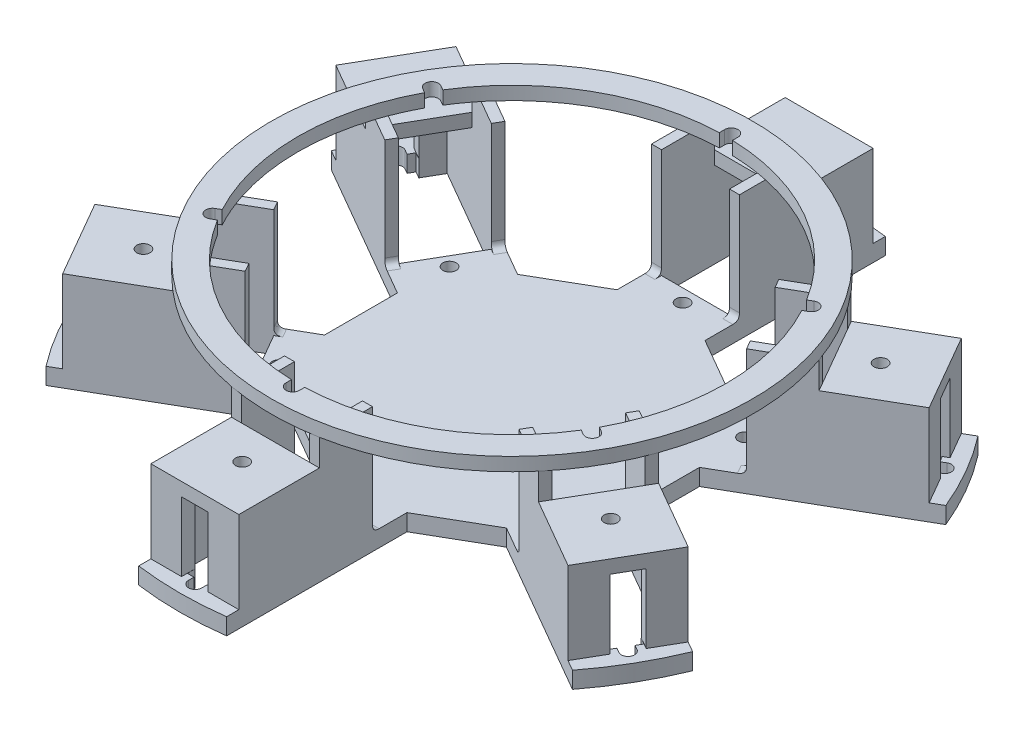
from build123d import *

# Parameters (mm, degrees)
SKETCH1_R               = 63.5
SKETCH1_R_2             = 1.27
BOSS_EXTRUDE2_DEPTH     = 3.175
CUT_EXTRUDE1_REACH      = 91.859
BOSS_EXTRUDE3_DEPTH     = 13.208
SKETCH4_W               = 5.08
SKETCH4_H               = 13.208
CUT_EXTRUDE2_DEPTH      = 13.208
CIRPATTERN2_COUNT       = 6
FILLET1_SIZE            = 1.27
SKETCH11_W              = 16.81
SKETCH11_H              = 15.402647586
BOSS_EXTRUDE7_DEPTH     = 2.54
SKETCH12_W              = 1.905
SKETCH12_H              = 10.137352414
BOSS_EXTRUDE9_DEPTH     = 7.62
SKETCH15_R              = 45.98147121
SKETCH15_R_2            = 40.90147121
BOSS_EXTRUDE12_DEPTH    = 2.54
CUT_EXTRUDE6_DEPTH      = 2.54
CUT_EXTRUDE7_DEPTH      = 89.528761012
CUT_EXTRUDE7_DEPTH_BACK = 89.528761012
SKETCH17_R              = 1.27


with BuildPart() as part:
    # Sketch1 → Boss-Extrude2 (new body)
    with BuildSketch(Plane(origin=(0, 0, 0), x_dir=(1, 0, 0), z_dir=(0, 1, 0))):
        with Locations(Location((0, 0, 0), (0, 0, 270))):
            Circle(SKETCH1_R)
        with Locations(Location((0, 32.599413337, 0), (0, 0, 270))):
            Circle(SKETCH1_R_2, mode=Mode.SUBTRACT)
        with Locations(Location((28.231920098, 16.299706668, 0), (0, 0, 270))):
            Circle(SKETCH1_R_2, mode=Mode.SUBTRACT)
        with Locations(Location((28.231920098, -16.299706668, 0), (0, 0, 270))):
            Circle(SKETCH1_R_2, mode=Mode.SUBTRACT)
        with Locations(Location((0, -32.599413337, 0), (0, 0, 270))):
            Circle(SKETCH1_R_2, mode=Mode.SUBTRACT)
        with Locations(Location((-28.231920098, -16.299706668, 0), (0, 0, 270))):
            Circle(SKETCH1_R_2, mode=Mode.SUBTRACT)
        with Locations(Location((-28.231920098, 16.299706668, 0), (0, 0, 270))):
            Circle(SKETCH1_R_2, mode=Mode.SUBTRACT)
        with BuildLine():
            Line((47.039587132, 34.663871793), (27.121002845, 23.163871793))
            Line((27.121002845, 23.163871793), (33.621002845, 11.905541544))
            Line((33.621002845, 11.905541544), (53.539587132, 23.405541544))
            Line((53.539587132, 23.405541544), (51.549939821, 26.851711776))
            Line((51.549939821, 26.851711776), (52.800278257, 27.573595009))
            Line((52.800278257, 27.573595009), (52.174925568, 28.656737638))
            Line((52.174925568, 28.656737638), (53.06366988, 29.169854406))
            ThreePointArc((53.06366988, 29.169854406), (53.528522143, 30.904706668), (51.79366988, 31.369558931))
            Line((51.79366988, 31.369558931), (50.904925568, 30.856442164))
            Line((50.904925568, 30.856442164), (50.279572879, 31.939584793))
            Line((50.279572879, 31.939584793), (49.029234444, 31.21770156))
            Line((49.029234444, 31.21770156), (47.039587132, 34.663871793))
        make_face(mode=Mode.SUBTRACT)
        with BuildLine():
            Line((-6.5, 58.069413337), (-2.520705377, 58.069413337))
            Line((-2.520705377, 58.069413337), (-2.520705377, 59.513179801))
            Line((-2.520705377, 59.513179801), (-1.27, 59.513179801))
            Line((-1.27, 59.513179801), (-1.27, 60.539413337))
            ThreePointArc((-1.27, 60.539413337), (0, 61.809413337), (1.27, 60.539413337))
            Line((1.27, 60.539413337), (1.27, 59.513179801))
            Line((1.27, 59.513179801), (2.520705377, 59.513179801))
            Line((2.520705377, 59.513179801), (2.520705377, 58.069413337))
            Line((2.520705377, 58.069413337), (6.5, 58.069413337))
            Line((6.5, 58.069413337), (6.5, 35.069413337))
            Line((6.5, 35.069413337), (-6.5, 35.069413337))
            Line((-6.5, 35.069413337), (-6.5, 58.069413337))
        make_face(mode=Mode.SUBTRACT)
        with BuildLine():
            Line((53.539587132, -23.405541544), (33.621002845, -11.905541544))
            Line((33.621002845, -11.905541544), (27.121002845, -23.163871793))
            Line((27.121002845, -23.163871793), (47.039587132, -34.663871793))
            Line((47.039587132, -34.663871793), (49.029234444, -31.21770156))
            Line((49.029234444, -31.21770156), (50.279572879, -31.939584793))
            Line((50.279572879, -31.939584793), (50.904925568, -30.856442164))
            Line((50.904925568, -30.856442164), (51.79366988, -31.369558931))
            ThreePointArc((51.79366988, -31.369558931), (53.528522143, -30.904706668), (53.06366988, -29.169854406))
            Line((53.06366988, -29.169854406), (52.174925568, -28.656737638))
            Line((52.174925568, -28.656737638), (52.800278257, -27.573595009))
            Line((52.800278257, -27.573595009), (51.549939821, -26.851711776))
            Line((51.549939821, -26.851711776), (53.539587132, -23.405541544))
        make_face(mode=Mode.SUBTRACT)
        with BuildLine():
            Line((6.5, -58.069413337), (6.5, -35.069413337))
            Line((6.5, -35.069413337), (-6.5, -35.069413337))
            Line((-6.5, -35.069413337), (-6.5, -58.069413337))
            Line((-6.5, -58.069413337), (-2.520705377, -58.069413337))
            Line((-2.520705377, -58.069413337), (-2.520705377, -59.513179801))
            Line((-2.520705377, -59.513179801), (-1.27, -59.513179801))
            Line((-1.27, -59.513179801), (-1.27, -60.539413337))
            ThreePointArc((-1.27, -60.539413337), (0, -61.809413337), (1.27, -60.539413337))
            Line((1.27, -60.539413337), (1.27, -59.513179801))
            Line((1.27, -59.513179801), (2.520705377, -59.513179801))
            Line((2.520705377, -59.513179801), (2.520705377, -58.069413337))
            Line((2.520705377, -58.069413337), (6.5, -58.069413337))
        make_face(mode=Mode.SUBTRACT)
        with BuildLine():
            Line((-47.039587132, -34.663871793), (-27.121002845, -23.163871793))
            Line((-27.121002845, -23.163871793), (-33.621002845, -11.905541544))
            Line((-33.621002845, -11.905541544), (-53.539587132, -23.405541544))
            Line((-53.539587132, -23.405541544), (-51.549939821, -26.851711776))
            Line((-51.549939821, -26.851711776), (-52.800278257, -27.573595009))
            Line((-52.800278257, -27.573595009), (-52.174925568, -28.656737638))
            Line((-52.174925568, -28.656737638), (-53.06366988, -29.169854406))
            ThreePointArc((-53.06366988, -29.169854406), (-53.528522143, -30.904706668), (-51.79366988, -31.369558931))
            Line((-51.79366988, -31.369558931), (-50.904925568, -30.856442164))
            Line((-50.904925568, -30.856442164), (-50.279572879, -31.939584793))
            Line((-50.279572879, -31.939584793), (-49.029234444, -31.21770156))
            Line((-49.029234444, -31.21770156), (-47.039587132, -34.663871793))
        make_face(mode=Mode.SUBTRACT)
        with BuildLine():
            Line((-53.539587132, 23.405541544), (-33.621002845, 11.905541544))
            Line((-33.621002845, 11.905541544), (-27.121002845, 23.163871793))
            Line((-27.121002845, 23.163871793), (-47.039587132, 34.663871793))
            Line((-47.039587132, 34.663871793), (-49.029234444, 31.21770156))
            Line((-49.029234444, 31.21770156), (-50.279572879, 31.939584793))
            Line((-50.279572879, 31.939584793), (-50.904925568, 30.856442164))
            Line((-50.904925568, 30.856442164), (-51.79366988, 31.369558931))
            ThreePointArc((-51.79366988, 31.369558931), (-53.528522143, 30.904706668), (-53.06366988, 29.169854406))
            Line((-53.06366988, 29.169854406), (-52.174925568, 28.656737638))
            Line((-52.174925568, 28.656737638), (-52.800278257, 27.573595009))
            Line((-52.800278257, 27.573595009), (-51.549939821, 26.851711776))
            Line((-51.549939821, 26.851711776), (-53.539587132, 23.405541544))
        make_face(mode=Mode.SUBTRACT)
    extrude(amount=BOSS_EXTRUDE2_DEPTH)

    # Sketch2 → Cut-Extrude1 (cut, up to next)
    with BuildSketch(Plane(origin=(0, 3.175, 0), x_dir=(1, 0, 0), z_dir=(0, 1, 0)), mode=Mode.PRIVATE) as cut_extrude1_sk1:
        with BuildLine():
            Line((-8.405, 28.480431649), (-20.462277319, 21.519159344))
            Line((-20.462277319, 21.519159344), (-50.306256005, 38.749588472))
            ThreePointArc((-50.306256005, 38.749588472), (-31.75, 54.99261314), (-8.405, 62.941289906))
            Line((-8.405, 62.941289906), (-8.405, 28.480431649))
        make_face()
    cut_extrude1_tool1 = extrude(cut_extrude1_sk1.sketch, amount=-CUT_EXTRUDE1_REACH, mode=Mode.PRIVATE) & part.part
    # Sketch2 → Cut-Extrude1 (cut, up to next)
    with BuildSketch(Plane(origin=(0, 3.175, 0), x_dir=(1, 0, 0), z_dir=(0, 1, 0)), mode=Mode.PRIVATE) as cut_extrude1_sk2:
        with BuildLine():
            Line((8.405, 28.480431649), (8.405, 62.941289906))
            ThreePointArc((8.405, 62.941289906), (31.75, 54.99261314), (50.306256005, 38.749588472))
            Line((50.306256005, 38.749588472), (20.462277319, 21.519159344))
            Line((20.462277319, 21.519159344), (8.405, 28.480431649))
        make_face()
    cut_extrude1_tool2 = extrude(cut_extrude1_sk2.sketch, amount=-CUT_EXTRUDE1_REACH, mode=Mode.PRIVATE) & part.part
    # Sketch2 → Cut-Extrude1 (cut, up to next)
    with BuildSketch(Plane(origin=(0, 3.175, 0), x_dir=(1, 0, 0), z_dir=(0, 1, 0)), mode=Mode.PRIVATE) as cut_extrude1_sk3:
        with BuildLine():
            Line((28.867277319, 6.961272306), (58.711256005, 24.191701434))
            ThreePointArc((58.711256005, 24.191701434), (63.5, 0), (58.711256005, -24.191701434))
            Line((58.711256005, -24.191701434), (28.867277319, -6.961272306))
            Line((28.867277319, -6.961272306), (28.867277319, 6.961272306))
        make_face()
    cut_extrude1_tool3 = extrude(cut_extrude1_sk3.sketch, amount=-CUT_EXTRUDE1_REACH, mode=Mode.PRIVATE) & part.part
    # Sketch2 → Cut-Extrude1 (cut, up to next)
    with BuildSketch(Plane(origin=(0, 3.175, 0), x_dir=(1, 0, 0), z_dir=(0, 1, 0)), mode=Mode.PRIVATE) as cut_extrude1_sk4:
        with BuildLine():
            Line((20.462277319, -21.519159344), (50.306256005, -38.749588472))
            ThreePointArc((50.306256005, -38.749588472), (31.75, -54.99261314), (8.405, -62.941289906))
            Line((8.405, -62.941289906), (8.405, -28.480431649))
            Line((8.405, -28.480431649), (20.462277319, -21.519159344))
        make_face()
    cut_extrude1_tool4 = extrude(cut_extrude1_sk4.sketch, amount=-CUT_EXTRUDE1_REACH, mode=Mode.PRIVATE) & part.part
    # Sketch2 → Cut-Extrude1 (cut, up to next)
    with BuildSketch(Plane(origin=(0, 3.175, 0), x_dir=(1, 0, 0), z_dir=(0, 1, 0)), mode=Mode.PRIVATE) as cut_extrude1_sk5:
        with BuildLine():
            Line((-8.405, -28.480431649), (-8.405, -62.941289906))
            ThreePointArc((-8.405, -62.941289906), (-31.75, -54.99261314), (-50.306256005, -38.749588472))
            Line((-50.306256005, -38.749588472), (-20.462277319, -21.519159344))
            Line((-20.462277319, -21.519159344), (-8.405, -28.480431649))
        make_face()
    cut_extrude1_tool5 = extrude(cut_extrude1_sk5.sketch, amount=-CUT_EXTRUDE1_REACH, mode=Mode.PRIVATE) & part.part
    # Sketch2 → Cut-Extrude1 (cut, up to next)
    with BuildSketch(Plane(origin=(0, 3.175, 0), x_dir=(1, 0, 0), z_dir=(0, 1, 0)), mode=Mode.PRIVATE) as cut_extrude1_sk6:
        with BuildLine():
            Line((-28.867277319, -6.961272306), (-58.711256005, -24.191701434))
            ThreePointArc((-58.711256005, -24.191701434), (-63.5, 0), (-58.711256005, 24.191701434))
            Line((-58.711256005, 24.191701434), (-28.867277319, 6.961272306))
            Line((-28.867277319, 6.961272306), (-28.867277319, -6.961272306))
        make_face()
    cut_extrude1_tool6 = extrude(cut_extrude1_sk6.sketch, amount=-CUT_EXTRUDE1_REACH, mode=Mode.PRIVATE) & part.part
    add(cut_extrude1_tool1.solids().sort_by_distance((-24.280761, 3.175, -42.055512))[0], mode=Mode.SUBTRACT)
    add(cut_extrude1_tool2.solids().sort_by_distance((24.280761, 3.175, -42.055512))[0], mode=Mode.SUBTRACT)
    add(cut_extrude1_tool3.solids().sort_by_distance((48.561522, 3.175, 0))[0], mode=Mode.SUBTRACT)
    add(cut_extrude1_tool4.solids().sort_by_distance((24.280761, 3.175, 42.055512))[0], mode=Mode.SUBTRACT)
    add(cut_extrude1_tool5.solids().sort_by_distance((-24.280761, 3.175, 42.055512))[0], mode=Mode.SUBTRACT)
    add(cut_extrude1_tool6.solids().sort_by_distance((-48.561522, 3.175, 0))[0], mode=Mode.SUBTRACT)

    # Sketch3 → Boss-Extrude3 (add)
    with BuildSketch(Plane(origin=(0, 3.175, 0), x_dir=(1, 0, 0), z_dir=(0, 1, 0))):
        Polygon((47.039587132, 34.663871793), (27.121002845, 23.163871793), (26.168502845, 24.813650187), (46.637013264, 36.631150187), (48.286791658, 37.583650187), (56.691791658, 23.02576315), (55.042013264, 22.07326315), (34.573502845, 10.25576315), (33.621002845, 11.905541544), (53.539587132, 23.405541544), align=None)
        Polygon((-6.5, 58.069413337), (-6.5, 35.069413337), (-8.405, 35.069413337), (-8.405, 58.704413337), (-8.405, 60.609413337), (8.405, 60.609413337), (8.405, 58.704413337), (8.405, 35.069413337), (6.5, 35.069413337), (6.5, 58.069413337), align=None)
        Polygon((53.539587132, -23.405541544), (33.621002845, -11.905541544), (34.573502845, -10.25576315), (55.042013264, -22.07326315), (56.691791658, -23.02576315), (48.286791658, -37.583650187), (46.637013264, -36.631150187), (26.168502845, -24.813650187), (27.121002845, -23.163871793), (47.039587132, -34.663871793), align=None)
        Polygon((6.5, -58.069413337), (6.5, -35.069413337), (8.405, -35.069413337), (8.405, -58.704413337), (8.405, -60.609413337), (-8.405, -60.609413337), (-8.405, -58.704413337), (-8.405, -35.069413337), (-6.5, -35.069413337), (-6.5, -58.069413337), align=None)
        Polygon((-47.039587132, -34.663871793), (-27.121002845, -23.163871793), (-26.168502845, -24.813650187), (-46.637013264, -36.631150187), (-48.286791658, -37.583650187), (-56.691791658, -23.02576315), (-55.042013264, -22.07326315), (-34.573502845, -10.25576315), (-33.621002845, -11.905541544), (-53.539587132, -23.405541544), align=None)
        Polygon((-53.539587132, 23.405541544), (-33.621002845, 11.905541544), (-34.573502845, 10.25576315), (-55.042013264, 22.07326315), (-56.691791658, 23.02576315), (-48.286791658, 37.583650187), (-46.637013264, 36.631150187), (-26.168502845, 24.813650187), (-27.121002845, 23.163871793), (-47.039587132, 34.663871793), align=None)
    extrude(amount=BOSS_EXTRUDE3_DEPTH)

    # Sketch4 → Cut-Extrude2 (cut)
    with BuildSketch(Plane(origin=(0, 0, -60.609413337), x_dir=(-1, 0, 0), z_dir=(0, 0, -1))):
        with Locations((0, 9.779)):
            Rectangle(SKETCH4_W, SKETCH4_H)
    cut_extrude2 = extrude(amount=-CUT_EXTRUDE2_DEPTH, mode=Mode.SUBTRACT)

    # CirPattern2: Cut-Extrude2 ×6 about axis
    cirpattern2_axis = Axis((0, 0, 0), (0, 1, 0))
    for i in range(1, CIRPATTERN2_COUNT):
        add(cut_extrude2.rotate(cirpattern2_axis, i * 360 / CIRPATTERN2_COUNT), mode=Mode.SUBTRACT)

    # Fillet1
    # a fillet whose section is not a circle: 1.27 mm, written as the material it adds along each edge
    with BuildSketch(Plane(origin=(27.121002845, 3.175, -23.163871793), x_dir=(-0.8660254037844389, 0, 0.4999999999999995), z_dir=(-0.4999999999999995, 0, -0.8660254037844389)), Plane(origin=(34.573502845, 3.175, -10.25576315), x_dir=(-0.8660254037844378, 0, 0.5000000000000013), z_dir=(-0.5000000000000013, 0, -0.8660254037844379)), Plane(origin=(33.621002845, 3.175, 11.905541544), x_dir=(-0.8660254037844397, 0, -0.49999999999999806), z_dir=(0.4999999999999981, 0, -0.8660254037844398)), Plane(origin=(26.168502845, 3.175, 24.813650187), x_dir=(-0.8660254037844389, 0, -0.4999999999999995), z_dir=(0.4999999999999995, 0, -0.8660254037844389)), Plane(origin=(-27.121002845, 3.175, 23.163871793), x_dir=(0.8660254037844389, 0, -0.4999999999999995), z_dir=(0.4999999999999995, 0, 0.8660254037844389)), Plane(origin=(-34.573502845, 3.175, 10.25576315), x_dir=(0.8660254037844385, 0, -0.5000000000000004), z_dir=(0.5000000000000004, 0, 0.8660254037844384)), Plane(origin=(-33.621002845, 3.175, -11.905541544), x_dir=(0.8660254037844386, 0, 0.5000000000000001), z_dir=(-0.5000000000000001, 0, 0.8660254037844387)), Plane(origin=(-26.168502845, 3.175, -24.813650187), x_dir=(0.8660254037844389, 0, 0.4999999999999995), z_dir=(-0.4999999999999995, 0, 0.8660254037844389)), Plane(origin=(-6.5, 3.175, -35.069413337), x_dir=(0, 0, 1), z_dir=(-1, 0, 0)), Plane(origin=(8.405, 3.175, -35.069413337), x_dir=(0, 0, 1), z_dir=(-1, 0, 0))) as fillet1_piece_1:
        with BuildLine():
            Bezier((FILLET1_SIZE, 0), (0, 0), (0, FILLET1_SIZE), weights=[1, 1, 1])
            Line((0, FILLET1_SIZE), (0, 0))
            Line((0, 0), (FILLET1_SIZE, 0))
        make_face()
    extrude(amount=1.905)
    with BuildSketch(Plane(origin=(6.5, 3.175, 35.069413337), x_dir=(0, 1, 0), z_dir=(1, 0, 0)), Plane(origin=(-8.405, 3.175, 35.069413337), x_dir=(0, 1, 0), z_dir=(1, 0, 0))) as fillet1_piece_2:
        with BuildLine():
            Bezier((FILLET1_SIZE, 0), (0, 0), (0, -FILLET1_SIZE), weights=[1, 1, 1])
            Line((0, -FILLET1_SIZE), (0, 0))
            Line((0, 0), (FILLET1_SIZE, 0))
        make_face()
    extrude(amount=1.905)

    # Sketch11 → Boss-Extrude7 (add)
    with BuildSketch(Plane(origin=(0, 16.383, 0), x_dir=(1, 0, 0), z_dir=(0, 1, 0))):
        Polygon((48.286791658, 37.583650187), (34.947707563, 29.882326394), (43.352707563, 15.324439356), (56.691791658, 23.02576315), align=None)
        with Locations((0, 52.908089544)):
            Rectangle(SKETCH11_W, SKETCH11_H)
        Polygon((56.691791658, -23.02576315), (43.352707563, -15.324439356), (34.947707563, -29.882326394), (48.286791658, -37.583650187), align=None)
        with Locations((0, -52.908089544)):
            Rectangle(SKETCH11_W, SKETCH11_H)
        Polygon((-48.286791658, -37.583650187), (-34.947707563, -29.882326394), (-43.352707563, -15.324439356), (-56.691791658, -23.02576315), align=None)
        Polygon((-56.691791658, 23.02576315), (-43.352707563, 15.324439356), (-34.947707563, 29.882326394), (-48.286791658, 37.583650187), align=None)
    extrude(amount=BOSS_EXTRUDE7_DEPTH)

    # Sketch12 → Boss-Extrude9 (add)
    with BuildSketch(Plane(origin=(0, 16.383, 0), x_dir=(1, 0, 0), z_dir=(0, 1, 0))):
        Polygon((34.947707563, 29.882326394), (35.900207563, 28.232548), (27.121002845, 23.163871793), (26.168502845, 24.813650187), align=None)
        with Locations((-7.4525, 40.138089544)):
            Rectangle(SKETCH12_W, SKETCH12_H)
        with Locations((7.4525, 40.138089544)):
            Rectangle(SKETCH12_W, SKETCH12_H)
        Polygon((34.573502845, 10.25576315), (33.621002845, 11.905541544), (42.400207563, 16.974217751), (43.352707563, 15.324439356), align=None)
        Polygon((43.352707563, -15.324439356), (42.400207563, -16.974217751), (33.621002845, -11.905541544), (34.573502845, -10.25576315), align=None)
        Polygon((26.168502845, -24.813650187), (27.121002845, -23.163871793), (35.900207563, -28.232548), (34.947707563, -29.882326394), align=None)
        with Locations((7.4525, -40.138089544)):
            Rectangle(SKETCH12_W, SKETCH12_H)
        with Locations((-7.4525, -40.138089544)):
            Rectangle(SKETCH12_W, SKETCH12_H)
        Polygon((-34.947707563, -29.882326394), (-35.900207563, -28.232548), (-27.121002845, -23.163871793), (-26.168502845, -24.813650187), align=None)
        Polygon((-34.573502845, -10.25576315), (-33.621002845, -11.905541544), (-42.400207563, -16.974217751), (-43.352707563, -15.324439356), align=None)
        Polygon((-43.352707563, 15.324439356), (-42.400207563, 16.974217751), (-33.621002845, 11.905541544), (-34.573502845, 10.25576315), align=None)
        Polygon((-26.168502845, 24.813650187), (-27.121002845, 23.163871793), (-35.900207563, 28.232548), (-34.947707563, 29.882326394), align=None)
    extrude(amount=BOSS_EXTRUDE9_DEPTH)

    # Sketch15 → Boss-Extrude12 (add)
    with BuildSketch(Plane(origin=(0, 24.003, 0), x_dir=(1, 0, 0), z_dir=(0, 1, 0))):
        with Locations(Location((0, 0, 0), (0, 0, 100.532371188))):
            Circle(SKETCH15_R)
        with Locations(Location((0, 0, 0), (0, 0, 80.855872964))):
            Circle(SKETCH15_R_2, mode=Mode.SUBTRACT)
    extrude(amount=BOSS_EXTRUDE12_DEPTH)

    # Sketch16 → Cut-Extrude6 (cut)
    with BuildSketch(Plane(origin=(0, 26.543, 0), x_dir=(1, 0, 0), z_dir=(0, 1, 0))):
        with BuildLine():
            Line((-1.27, 41.91), (-1.27, 39.191421012))
            Line((-1.27, 39.191421012), (1.27, 39.191421012))
            Line((1.27, 39.191421012), (1.27, 41.91))
            ThreePointArc((1.27, 41.91), (0, 43.18), (-1.27, 41.91))
        make_face()
        with BuildLine():
            Line((35.660124673, 22.054852263), (33.305766207, 20.695562769))
            Line((33.305766207, 20.695562769), (34.575766207, 18.495858243))
            Line((34.575766207, 18.495858243), (36.930124673, 19.855147737))
            ThreePointArc((36.930124673, 19.855147737), (37.394976935, 21.59), (35.660124673, 22.054852263))
        make_face()
        with BuildLine():
            Line((36.930124673, -19.855147737), (34.575766207, -18.495858243))
            Line((34.575766207, -18.495858243), (33.305766207, -20.695562769))
            Line((33.305766207, -20.695562769), (35.660124673, -22.054852263))
            ThreePointArc((35.660124673, -22.054852263), (37.394976935, -21.59), (36.930124673, -19.855147737))
        make_face()
        with BuildLine():
            Line((1.27, -41.91), (1.27, -39.191421012))
            Line((1.27, -39.191421012), (-1.27, -39.191421012))
            Line((-1.27, -39.191421012), (-1.27, -41.91))
            ThreePointArc((-1.27, -41.91), (0, -43.18), (1.27, -41.91))
        make_face()
        with BuildLine():
            Line((-35.660124673, -22.054852263), (-33.305766207, -20.695562769))
            Line((-33.305766207, -20.695562769), (-34.575766207, -18.495858243))
            Line((-34.575766207, -18.495858243), (-36.930124673, -19.855147737))
            ThreePointArc((-36.930124673, -19.855147737), (-37.394976935, -21.59), (-35.660124673, -22.054852263))
        make_face()
        with BuildLine():
            Line((-36.930124673, 19.855147737), (-34.575766207, 18.495858243))
            Line((-34.575766207, 18.495858243), (-33.305766207, 20.695562769))
            Line((-33.305766207, 20.695562769), (-35.660124673, 22.054852263))
            ThreePointArc((-35.660124673, 22.054852263), (-37.394976935, 21.59), (-36.930124673, 19.855147737))
        make_face()
    extrude(amount=-CUT_EXTRUDE6_DEPTH, mode=Mode.SUBTRACT)

    # Sketch17 → Cut-Extrude7 (cut, two sides: drawn at the far end of the back side and taken through both)
    with BuildSketch(Plane(origin=(0, 18.923, 0), x_dir=(1, 0, 0), z_dir=(0, 1, 0)).offset(-CUT_EXTRUDE7_DEPTH_BACK)):
        with Locations(Location((0, 51.567013337, 0), (0, 0, 270))):
            Circle(SKETCH17_R)
        with Locations(Location((44.658343547, 25.783506668, 0), (0, 0, 90))):
            Circle(SKETCH17_R)
        with Locations(Location((44.658343547, -25.783506668, 0), (0, 0, 90))):
            Circle(SKETCH17_R)
        with Locations(Location((0, -51.567013337, 0), (0, 0, 90))):
            Circle(SKETCH17_R)
        with Locations(Location((-44.658343547, -25.783506668, 0), (0, 0, 90))):
            Circle(SKETCH17_R)
        with Locations(Location((-44.658343547, 25.783506668, 0), (0, 0, 90))):
            Circle(SKETCH17_R)
    extrude(amount=CUT_EXTRUDE7_DEPTH + CUT_EXTRUDE7_DEPTH_BACK, mode=Mode.SUBTRACT)


solid = part.part
